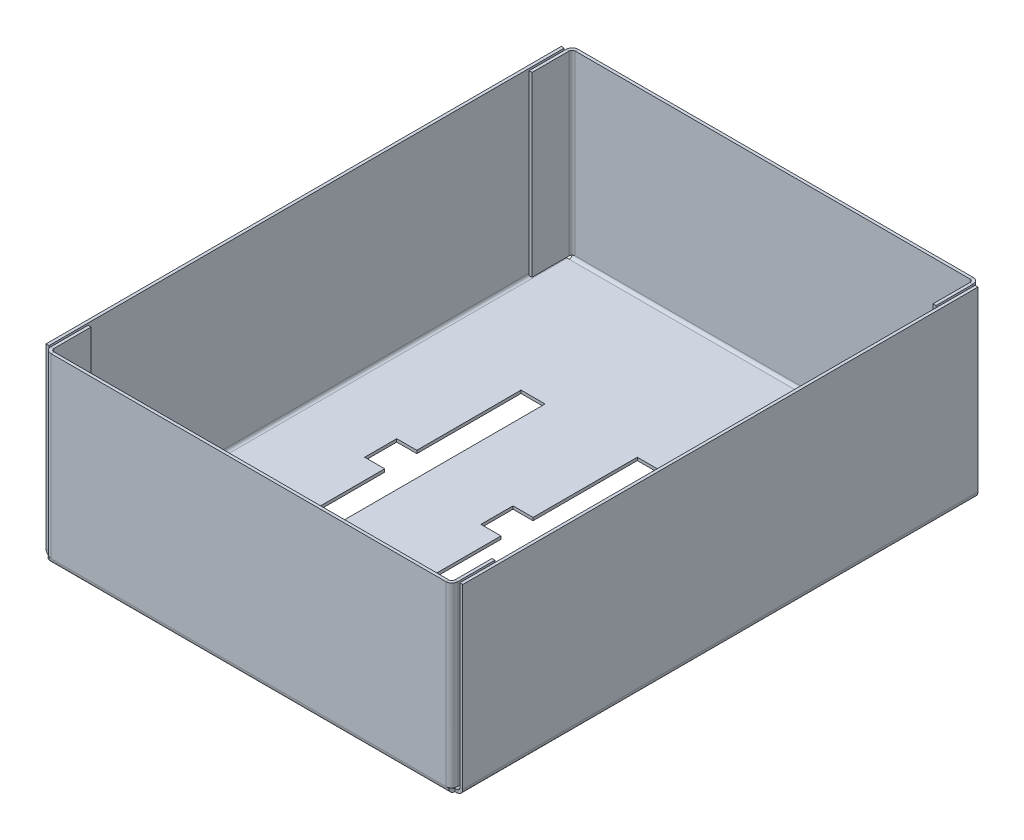
from build123d import *

# Parameters (mm, degrees)
SKETCH1_W                        = 100
SKETCH1_H                        = 130
BASE_FLANGE1_DEPTH               = 0.7366
BOX_REAR_STRIP_W                 = 4.4196
BOX_REAR_STRIP_H                 = 0.7366
BOX_REAR_STRIP_CUT_DEPTH         = 100
BOX_REAR_DEPTH                   = 100
BOX_FRONT_STRIP_W                = 4.4196
BOX_FRONT_STRIP_H                = 0.7366
BOX_FRONT_STRIP_CUT_DEPTH        = 100
BOX_FRONT_DEPTH                  = 100
BOX_FRONT_TABS_STRIP_W           = 4.4196
BOX_FRONT_TABS_STRIP_H           = 0.7366
BOX_FRONT_TABS_STRIP_CUT_DEPTH   = 44.2634
BOX_FRONT_TABS_STRIP_2_W         = 4.4196
BOX_FRONT_TABS_STRIP_2_H         = 0.7366
BOX_FRONT_TABS_STRIP_CUT_2_DEPTH = 44.2634
BOX_FRONT_TABS_DEPTH             = 44.2634
BOX_FRONT_TABS_BEND_DEPTH        = 44.2634
BOX_REAR_TABS_STRIP_W            = 4.4196
BOX_REAR_TABS_STRIP_H            = 0.7366
BOX_REAR_TABS_STRIP_CUT_DEPTH    = 44.2634
BOX_REAR_TABS_STRIP_2_W          = 4.4196
BOX_REAR_TABS_STRIP_2_H          = 0.7366
BOX_REAR_TABS_STRIP_CUT_2_DEPTH  = 44.2634
BOX_REAR_TABS_DEPTH              = 44.2634
BOX_REAR_TABS_BEND_DEPTH         = 44.2634
EDGE_FLANGE6_DEPTH               = 128.5268
EDGE_FLANGE6_START               = 0.7366
EDGE_FLANGE6_FLAT_DEPTH          = 0.7366
EDGE_FLANGE6_BEND_DEPTH          = 128.5268
EDGE_FLANGE6_FLAT_2_DEPTH        = 0.7366


# Sheet-metal steps are written as plain solids
with BuildPart() as part:
    # Sketch1 → Base-Flange1 (new body)
    with BuildSketch(Plane(origin=(0, 0, 0), x_dir=(1, 0, 0), z_dir=(0, 1, 0))):
        Rectangle(SKETCH1_W, SKETCH1_H)
        Polygon((1.25, 30), (7.25, 30), (7.25, -30), (1.25, -30), (1.25, -4), (-3.75, -4), (-3.75, 4), (1.25, 4), align=None, mode=Mode.SUBTRACT)
        Polygon((30.25, 30), (36.25, 30), (36.25, -30), (30.25, -30), (30.25, -4), (25.25, -4), (25.25, 4), (30.25, 4), align=None, mode=Mode.SUBTRACT)
        Polygon((-27.75, 30), (-21.75, 30), (-21.75, -30), (-27.75, -30), (-27.75, -4), (-32.75, -4), (-32.75, 4), (-27.75, 4), align=None, mode=Mode.SUBTRACT)
    extrude(amount=-BASE_FLANGE1_DEPTH)

    # Box rear strip (across the edge) → Box rear strip cut (cut)
    with BuildSketch(Plane(origin=(50, 0, -65), x_dir=(0, 0, 1), z_dir=(-1, 0, 0))):
        with Locations((-1.4732, -0.3683)):
            Rectangle(BOX_REAR_STRIP_W, BOX_REAR_STRIP_H)
    extrude(amount=BOX_REAR_STRIP_CUT_DEPTH, mode=Mode.SUBTRACT)

    # Box rear section (across the edge) → Box rear (add)
    with BuildSketch(Plane(origin=(50, 0, -65), x_dir=(0, 0, 1), z_dir=(-1, 0, 0))):
        with BuildLine():
            Line((-0.7366, 0.7366), (-0.7366, 45))
            Line((-0.7366, 45), (0, 45))
            Line((0, 45), (0, 0.7366))
            ThreePointArc((0, 0.7366), (0.215745145, 0.215745145), (0.7366, 0))
            Line((0.7366, 0), (0.7366, -0.7366))
            ThreePointArc((0.7366, -0.7366), (-0.30510971, -0.30510971), (-0.7366, 0.7366))
        make_face()
    extrude(amount=BOX_REAR_DEPTH)

    # Box front strip (across the edge) → Box front strip cut (cut)
    with BuildSketch(Plane(origin=(-50, 0, 65), x_dir=(0, 0, -1), z_dir=(1, 0, 0))):
        with Locations((-1.4732, -0.3683)):
            Rectangle(BOX_FRONT_STRIP_W, BOX_FRONT_STRIP_H)
    extrude(amount=BOX_FRONT_STRIP_CUT_DEPTH, mode=Mode.SUBTRACT)

    # Box front section (across the edge) → Box front (add)
    with BuildSketch(Plane(origin=(-50, 0, 65), x_dir=(0, 0, -1), z_dir=(1, 0, 0))):
        with BuildLine():
            Line((-0.7366, 0.7366), (-0.7366, 45))
            Line((-0.7366, 45), (0, 45))
            Line((0, 45), (0, 0.7366))
            ThreePointArc((0, 0.7366), (0.215745145, 0.215745145), (0.7366, 0))
            Line((0.7366, 0), (0.7366, -0.7366))
            ThreePointArc((0.7366, -0.7366), (-0.30510971, -0.30510971), (-0.7366, 0.7366))
        make_face()
    extrude(amount=BOX_FRONT_DEPTH)

    # Box-front tabs strip (across the edge) → Box-front tabs strip cut (cut)
    with BuildSketch(Plane(origin=(-50, 0.7366, 65), x_dir=(1, 0, 0), z_dir=(0, 1, 0))):
        with Locations((-1.4732, -0.3683)):
            Rectangle(BOX_FRONT_TABS_STRIP_W, BOX_FRONT_TABS_STRIP_H)
    extrude(amount=BOX_FRONT_TABS_STRIP_CUT_DEPTH, mode=Mode.SUBTRACT)

    # Box-front tabs strip 2 (across the edge) → Box-front tabs strip cut 2 (cut)
    with BuildSketch(Plane(origin=(50, 45, 65), x_dir=(-1, 0, 0), z_dir=(0, -1, 0))):
        with Locations((-1.4732, -0.3683)):
            Rectangle(BOX_FRONT_TABS_STRIP_2_W, BOX_FRONT_TABS_STRIP_2_H)
    extrude(amount=BOX_FRONT_TABS_STRIP_CUT_2_DEPTH, mode=Mode.SUBTRACT)

    # Box-front tabs section (across the edge) → Box-front tabs (add)
    with BuildSketch(Plane(origin=(-50, 0.7366, 65), x_dir=(1, 0, 0), z_dir=(0, 1, 0))):
        with BuildLine():
            Line((-0.7366, 0.7366), (-0.7366, 10))
            Line((-0.7366, 10), (0, 10))
            Line((0, 10), (0, 0.7366))
            ThreePointArc((0, 0.7366), (0.215745145, 0.215745145), (0.7366, 0))
            Line((0.7366, 0), (0.7366, -0.7366))
            ThreePointArc((0.7366, -0.7366), (-0.30510971, -0.30510971), (-0.7366, 0.7366))
        make_face()
    extrude(amount=BOX_FRONT_TABS_DEPTH)

    # Box-front tabs section 2 (across the edge) → Box-front tabs bend (add)
    with BuildSketch(Plane(origin=(50, 45, 65), x_dir=(-1, 0, 0), z_dir=(0, -1, 0))):
        with BuildLine():
            Line((-0.7366, 0.7366), (-0.7366, 10))
            Line((-0.7366, 10), (0, 10))
            Line((0, 10), (0, 0.7366))
            ThreePointArc((0, 0.7366), (0.215745145, 0.215745145), (0.7366, 0))
            Line((0.7366, 0), (0.7366, -0.7366))
            ThreePointArc((0.7366, -0.7366), (-0.30510971, -0.30510971), (-0.7366, 0.7366))
        make_face()
    extrude(amount=BOX_FRONT_TABS_BEND_DEPTH)

    # Box-rear tabs strip (across the edge) → Box-rear tabs strip cut (cut)
    with BuildSketch(Plane(origin=(50, 0.7366, -65), x_dir=(-1, 0, 0), z_dir=(0, 1, 0))):
        with Locations((-1.4732, -0.3683)):
            Rectangle(BOX_REAR_TABS_STRIP_W, BOX_REAR_TABS_STRIP_H)
    extrude(amount=BOX_REAR_TABS_STRIP_CUT_DEPTH, mode=Mode.SUBTRACT)

    # Box-rear tabs strip 2 (across the edge) → Box-rear tabs strip cut 2 (cut)
    with BuildSketch(Plane(origin=(-50, 45, -65), x_dir=(1, 0, 0), z_dir=(0, -1, 0))):
        with Locations((-1.4732, -0.3683)):
            Rectangle(BOX_REAR_TABS_STRIP_2_W, BOX_REAR_TABS_STRIP_2_H)
    extrude(amount=BOX_REAR_TABS_STRIP_CUT_2_DEPTH, mode=Mode.SUBTRACT)

    # Box-rear tabs section (across the edge) → Box-rear tabs (add)
    with BuildSketch(Plane(origin=(50, 0.7366, -65), x_dir=(-1, 0, 0), z_dir=(0, 1, 0))):
        with BuildLine():
            Line((-0.7366, 0.7366), (-0.7366, 10))
            Line((-0.7366, 10), (0, 10))
            Line((0, 10), (0, 0.7366))
            ThreePointArc((0, 0.7366), (0.215745145, 0.215745145), (0.7366, 0))
            Line((0.7366, 0), (0.7366, -0.7366))
            ThreePointArc((0.7366, -0.7366), (-0.30510971, -0.30510971), (-0.7366, 0.7366))
        make_face()
    extrude(amount=BOX_REAR_TABS_DEPTH)

    # Box-rear tabs section 2 (across the edge) → Box-rear tabs bend (add)
    with BuildSketch(Plane(origin=(-50, 45, -65), x_dir=(1, 0, 0), z_dir=(0, -1, 0))):
        with BuildLine():
            Line((-0.7366, 0.7366), (-0.7366, 10))
            Line((-0.7366, 10), (0, 10))
            Line((0, 10), (0, 0.7366))
            ThreePointArc((0, 0.7366), (0.215745145, 0.215745145), (0.7366, 0))
            Line((0.7366, 0), (0.7366, -0.7366))
            ThreePointArc((0.7366, -0.7366), (-0.30510971, -0.30510971), (-0.7366, 0.7366))
        make_face()
    extrude(amount=BOX_REAR_TABS_BEND_DEPTH)

    # Edge-Flange6 bend section (across the edge) → Edge-Flange6 (add)
    with BuildSketch(Plane(origin=(-51.2366, 0, -64.2634), x_dir=(1, 0, 0), z_dir=(0, 0, 1))):
        with BuildLine():
            Line((-0.7366, 0.7366), (0, 0.7366))
            ThreePointArc((0, 0.7366), (0.215745145, 0.215745145), (0.7366, 0))
            Line((0.7366, 0), (1.2366, 0))
            Line((1.2366, 0), (1.2366, -0.7366))
            Line((1.2366, -0.7366), (0.7366, -0.7366))
            ThreePointArc((0.7366, -0.7366), (-0.30510971, -0.30510971), (-0.7366, 0.7366))
        make_face()
    extrude(amount=EDGE_FLANGE6_DEPTH)

    # Edge-Flange6 profile (on flange) → Edge-Flange6 flat (add)
    with BuildSketch(Plane.ZY.offset(51.2366).offset(EDGE_FLANGE6_START)):
        Polygon((-64.2634, 45), (-64.2634, 0.7366), (64.2634, 0.7366), (64.2634, 45), (-2.12, 45), align=None)
    extrude(amount=-EDGE_FLANGE6_FLAT_DEPTH)

    # Edge-Flange6 bend section 2 (across the edge) → Edge-Flange6 bend (add)
    with BuildSketch(Plane(origin=(51.2366, 0, 64.2634), x_dir=(-1, 0, 0), z_dir=(0, 0, -1))):
        with BuildLine():
            Line((-0.7366, 0.7366), (0, 0.7366))
            ThreePointArc((0, 0.7366), (0.215745145, 0.215745145), (0.7366, 0))
            Line((0.7366, 0), (1.2366, 0))
            Line((1.2366, 0), (1.2366, -0.7366))
            Line((1.2366, -0.7366), (0.7366, -0.7366))
            ThreePointArc((0.7366, -0.7366), (-0.30510971, -0.30510971), (-0.7366, 0.7366))
        make_face()
    extrude(amount=EDGE_FLANGE6_BEND_DEPTH)

    # Edge-Flange6 profile 2 (on flange) → Edge-Flange6 flat 2 (add)
    with BuildSketch(Plane(origin=(51.2366, 0, 0), x_dir=(0, 0, -1), z_dir=(1, 0, 0)).offset(EDGE_FLANGE6_START)):
        Polygon((-64.2634, 45), (-64.2634, 0.7366), (64.2634, 0.7366), (64.2634, 45), (-2.12, 45), align=None)
    extrude(amount=-EDGE_FLANGE6_FLAT_2_DEPTH)


solid = part.part
